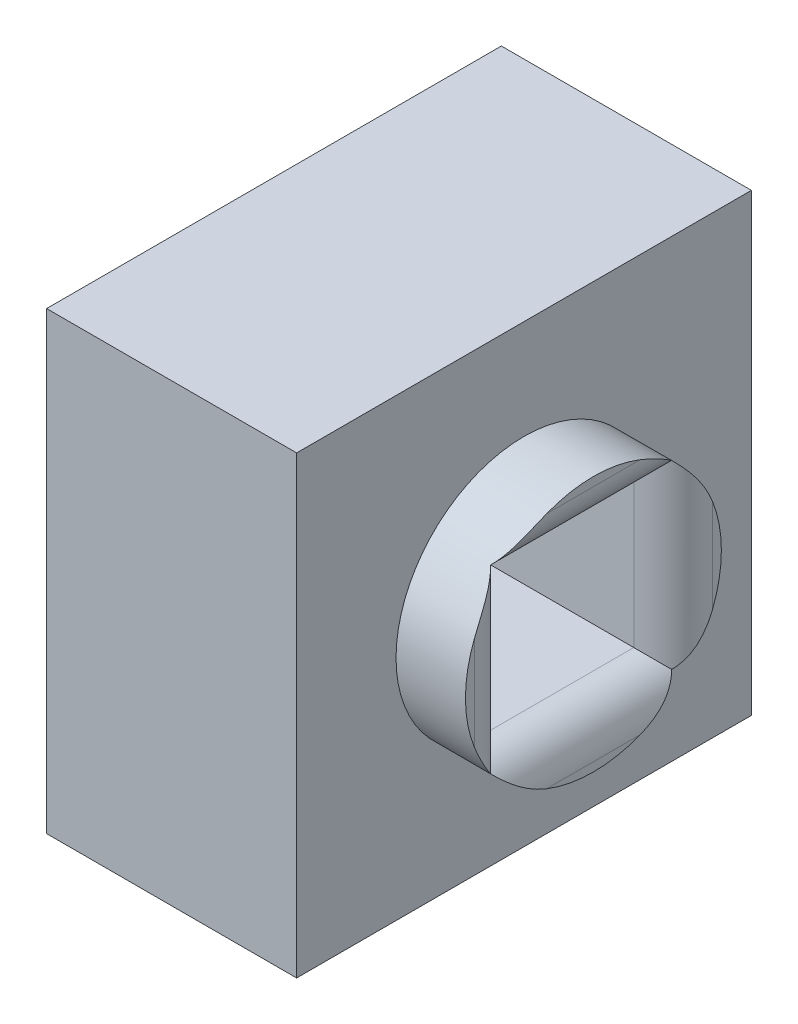
from build123d import *

# Parameters (mm, degrees)
SKETCH2_W           = 23.1
SKETCH2_H           = 23.1
SKETCH2_W_2         = 8.1
SKETCH2_H_2         = 8.1
EXTRUDE_THIN1_DEPTH = 12.7
SKETCH3_R           = 6.5
SKETCH3_W           = 8.1
SKETCH3_H           = 8.1
BOSS_EXTRUDE1_DEPTH = 3.525
FILLET1_R           = 2


with BuildPart() as part:
    # Sketch2 → Extrude-Thin1 (new body)
    with BuildSketch(Plane(origin=(0, 0, 0), x_dir=(0, 0, -1), z_dir=(1, 0, 0))):
        with Locations((4.05, 4.05)):
            Rectangle(SKETCH2_W, SKETCH2_H)
        with Locations((4.05, 4.05)):
            Rectangle(SKETCH2_W_2, SKETCH2_H_2, mode=Mode.SUBTRACT)
    extrude(amount=EXTRUDE_THIN1_DEPTH)

    # Sketch3 → Boss-Extrude1 (add)
    with BuildSketch(Plane(origin=(12.7, 0, 0), x_dir=(0, 0, -1), z_dir=(1, 0, 0))):
        with Locations((4.05, 4.05)):
            Circle(SKETCH3_R)
        with Locations((4.05, 4.05)):
            Rectangle(SKETCH3_W, SKETCH3_H, mode=Mode.SUBTRACT)
    extrude(amount=BOSS_EXTRUDE1_DEPTH)

    # Fillet1
    # the kernel refuses this fillet: 2 mm, written as the material it takes off along each edge
    with BuildSketch(Plane(origin=(0, 8.1, 0), x_dir=(1, 0, 0), z_dir=(0, -1, 0)), Plane(origin=(0, 0, 0), x_dir=(1, 0, 0), z_dir=(0, 0, -1)), Plane(origin=(0, 0, -8.1), x_dir=(1, 0, 0), z_dir=(0, 1, 0)), Plane(origin=(0, 8.1, -8.1), x_dir=(1, 0, 0), z_dir=(0, 0, 1))) as fillet1_piece_1:
        with BuildLine():
            CenterArc((FILLET1_R, FILLET1_R), FILLET1_R, 180, 90)
            Line((0, FILLET1_R), (-FILLET1_R * 0.02, FILLET1_R))
            Line((-FILLET1_R * 0.02, FILLET1_R), (-FILLET1_R * 0.02, -FILLET1_R * 0.02))
            Line((-FILLET1_R * 0.02, -FILLET1_R * 0.02), (FILLET1_R, -FILLET1_R * 0.02))
            Line((FILLET1_R, -FILLET1_R * 0.02), (FILLET1_R, 0))
        make_face()
    extrude(amount=8.1, mode=Mode.SUBTRACT)
    with BuildSketch(Plane(origin=(16.225, 0, -8.1), x_dir=(0, -1, 0), z_dir=(0, 0, 1)), Plane(origin=(16.225, 8.1, -8.1), x_dir=(0, 0, -1), z_dir=(0, -1, 0)), Plane(origin=(16.225, 8.1, 0), x_dir=(0, 1, 0), z_dir=(0, 0, -1)), Plane(origin=(16.225, 0, 0), x_dir=(0, 0, 1), z_dir=(0, 1, 0))) as fillet1_piece_2:
        with BuildLine():
            CenterArc((FILLET1_R, -FILLET1_R), FILLET1_R, 90, 90)
            Line((0, -FILLET1_R), (-FILLET1_R * 0.02, -FILLET1_R))
            Line((-FILLET1_R * 0.02, -FILLET1_R), (-FILLET1_R * 0.02, FILLET1_R * 0.02))
            Line((-FILLET1_R * 0.02, FILLET1_R * 0.02), (FILLET1_R, FILLET1_R * 0.02))
            Line((FILLET1_R, FILLET1_R * 0.02), (FILLET1_R, 0))
        make_face()
    extrude(amount=8.1, mode=Mode.SUBTRACT)
    with BuildSketch(Plane(origin=(0, 13.1, 0), x_dir=(1, 0, 0), z_dir=(0, -1, 0))) as fillet1_piece_3a_section:
        with BuildLine():
            CenterArc((FILLET1_R, FILLET1_R), FILLET1_R, 180, 90)
            Line((0, FILLET1_R), (-FILLET1_R * 0.02, FILLET1_R))
            Line((-FILLET1_R * 0.02, FILLET1_R), (-FILLET1_R * 0.02, -FILLET1_R * 0.02))
            Line((-FILLET1_R * 0.02, -FILLET1_R * 0.02), (FILLET1_R, -FILLET1_R * 0.02))
            Line((FILLET1_R, -FILLET1_R * 0.02), (FILLET1_R, 0))
        make_face()
    fillet1_piece_3a = extrude(amount=13.1, mode=Mode.PRIVATE)
    fillet1_piece_3a = split(fillet1_piece_3a, bisect_by=Plane(origin=(0.452790229, 8.1, 0.452790229), z_dir=(0, 1, 0)), keep=Keep.TOP, mode=Mode.PRIVATE)
    with BuildSketch(Plane(origin=(0, 8.1, -8.1), x_dir=(1, 0, 0), z_dir=(0, 0, 1))) as fillet1_piece_3b_section:
        with BuildLine():
            CenterArc((FILLET1_R, FILLET1_R), FILLET1_R, 180, 90)
            Line((0, FILLET1_R), (-FILLET1_R * 0.02, FILLET1_R))
            Line((-FILLET1_R * 0.02, FILLET1_R), (-FILLET1_R * 0.02, -FILLET1_R * 0.02))
            Line((-FILLET1_R * 0.02, -FILLET1_R * 0.02), (FILLET1_R, -FILLET1_R * 0.02))
            Line((FILLET1_R, -FILLET1_R * 0.02), (FILLET1_R, 0))
        make_face()
    fillet1_piece_3b = extrude(amount=13.1, mode=Mode.PRIVATE)
    fillet1_piece_3b = split(fillet1_piece_3b, bisect_by=Plane(origin=(0.452790229, 8.552790229, 0), z_dir=(0, 0, 1)), keep=Keep.TOP, mode=Mode.PRIVATE)
    fillet1_piece_3 = fillet1_piece_3a & fillet1_piece_3b
    add(fillet1_piece_3, mode=Mode.SUBTRACT)
    with BuildSketch(Plane(origin=(0, 8.1, 0), x_dir=(1, 0, 0), z_dir=(0, -1, 0))) as fillet1_piece_4a_section:
        with BuildLine():
            CenterArc((FILLET1_R, FILLET1_R), FILLET1_R, 180, 90)
            Line((0, FILLET1_R), (-FILLET1_R * 0.02, FILLET1_R))
            Line((-FILLET1_R * 0.02, FILLET1_R), (-FILLET1_R * 0.02, -FILLET1_R * 0.02))
            Line((-FILLET1_R * 0.02, -FILLET1_R * 0.02), (FILLET1_R, -FILLET1_R * 0.02))
            Line((FILLET1_R, -FILLET1_R * 0.02), (FILLET1_R, 0))
        make_face()
    fillet1_piece_4a = extrude(amount=13.1, mode=Mode.PRIVATE)
    fillet1_piece_4a = split(fillet1_piece_4a, bisect_by=Plane(origin=(0.452790229, 0, 0.452790229), z_dir=(0, -1, 0)), keep=Keep.TOP, mode=Mode.PRIVATE)
    with BuildSketch(Plane(origin=(0, 0, 5), x_dir=(1, 0, 0), z_dir=(0, 0, -1))) as fillet1_piece_4b_section:
        with BuildLine():
            CenterArc((FILLET1_R, FILLET1_R), FILLET1_R, 180, 90)
            Line((0, FILLET1_R), (-FILLET1_R * 0.02, FILLET1_R))
            Line((-FILLET1_R * 0.02, FILLET1_R), (-FILLET1_R * 0.02, -FILLET1_R * 0.02))
            Line((-FILLET1_R * 0.02, -FILLET1_R * 0.02), (FILLET1_R, -FILLET1_R * 0.02))
            Line((FILLET1_R, -FILLET1_R * 0.02), (FILLET1_R, 0))
        make_face()
    fillet1_piece_4b = extrude(amount=13.1, mode=Mode.PRIVATE)
    fillet1_piece_4b = split(fillet1_piece_4b, bisect_by=Plane(origin=(0.452790229, -0.452790229, 0), z_dir=(0, 0, 1)), keep=Keep.TOP, mode=Mode.PRIVATE)
    fillet1_piece_4 = fillet1_piece_4a & fillet1_piece_4b
    add(fillet1_piece_4, mode=Mode.SUBTRACT)
    with BuildSketch(Plane(origin=(0, 0, 0), x_dir=(1, 0, 0), z_dir=(0, 0, -1))) as fillet1_piece_5a_section:
        with BuildLine():
            CenterArc((FILLET1_R, FILLET1_R), FILLET1_R, 180, 90)
            Line((0, FILLET1_R), (-FILLET1_R * 0.02, FILLET1_R))
            Line((-FILLET1_R * 0.02, FILLET1_R), (-FILLET1_R * 0.02, -FILLET1_R * 0.02))
            Line((-FILLET1_R * 0.02, -FILLET1_R * 0.02), (FILLET1_R, -FILLET1_R * 0.02))
            Line((FILLET1_R, -FILLET1_R * 0.02), (FILLET1_R, 0))
        make_face()
    fillet1_piece_5a = extrude(amount=13.1, mode=Mode.PRIVATE)
    fillet1_piece_5a = split(fillet1_piece_5a, bisect_by=Plane(origin=(0.452790229, -0.452790229, -8.1), z_dir=(0, 0, -1)), keep=Keep.TOP, mode=Mode.PRIVATE)
    with BuildSketch(Plane(origin=(0, -5, -8.1), x_dir=(1, 0, 0), z_dir=(0, 1, 0))) as fillet1_piece_5b_section:
        with BuildLine():
            CenterArc((FILLET1_R, FILLET1_R), FILLET1_R, 180, 90)
            Line((0, FILLET1_R), (-FILLET1_R * 0.02, FILLET1_R))
            Line((-FILLET1_R * 0.02, FILLET1_R), (-FILLET1_R * 0.02, -FILLET1_R * 0.02))
            Line((-FILLET1_R * 0.02, -FILLET1_R * 0.02), (FILLET1_R, -FILLET1_R * 0.02))
            Line((FILLET1_R, -FILLET1_R * 0.02), (FILLET1_R, 0))
        make_face()
    fillet1_piece_5b = extrude(amount=13.1, mode=Mode.PRIVATE)
    fillet1_piece_5b = split(fillet1_piece_5b, bisect_by=Plane(origin=(0.452790229, 0, -8.552790229), z_dir=(0, -1, 0)), keep=Keep.TOP, mode=Mode.PRIVATE)
    fillet1_piece_5 = fillet1_piece_5a & fillet1_piece_5b
    add(fillet1_piece_5, mode=Mode.SUBTRACT)
    with BuildSketch(Plane(origin=(0, 0, -8.1), x_dir=(1, 0, 0), z_dir=(0, 1, 0))) as fillet1_piece_6a_section:
        with BuildLine():
            CenterArc((FILLET1_R, FILLET1_R), FILLET1_R, 180, 90)
            Line((0, FILLET1_R), (-FILLET1_R * 0.02, FILLET1_R))
            Line((-FILLET1_R * 0.02, FILLET1_R), (-FILLET1_R * 0.02, -FILLET1_R * 0.02))
            Line((-FILLET1_R * 0.02, -FILLET1_R * 0.02), (FILLET1_R, -FILLET1_R * 0.02))
            Line((FILLET1_R, -FILLET1_R * 0.02), (FILLET1_R, 0))
        make_face()
    fillet1_piece_6a = extrude(amount=13.1, mode=Mode.PRIVATE)
    fillet1_piece_6a = split(fillet1_piece_6a, bisect_by=Plane(origin=(0.452790229, 8.1, -8.552790229), z_dir=(0, 1, 0)), keep=Keep.TOP, mode=Mode.PRIVATE)
    with BuildSketch(Plane(origin=(0, 8.1, -13.1), x_dir=(1, 0, 0), z_dir=(0, 0, 1))) as fillet1_piece_6b_section:
        with BuildLine():
            CenterArc((FILLET1_R, FILLET1_R), FILLET1_R, 180, 90)
            Line((0, FILLET1_R), (-FILLET1_R * 0.02, FILLET1_R))
            Line((-FILLET1_R * 0.02, FILLET1_R), (-FILLET1_R * 0.02, -FILLET1_R * 0.02))
            Line((-FILLET1_R * 0.02, -FILLET1_R * 0.02), (FILLET1_R, -FILLET1_R * 0.02))
            Line((FILLET1_R, -FILLET1_R * 0.02), (FILLET1_R, 0))
        make_face()
    fillet1_piece_6b = extrude(amount=13.1, mode=Mode.PRIVATE)
    fillet1_piece_6b = split(fillet1_piece_6b, bisect_by=Plane(origin=(0.452790229, 8.552790229, -8.1), z_dir=(0, 0, -1)), keep=Keep.TOP, mode=Mode.PRIVATE)
    fillet1_piece_6 = fillet1_piece_6a & fillet1_piece_6b
    add(fillet1_piece_6, mode=Mode.SUBTRACT)
    with BuildSketch(Plane(origin=(16.225, 8.1, -8.1), x_dir=(0, 0, -1), z_dir=(0, -1, 0))) as fillet1_piece_7a_section:
        with BuildLine():
            CenterArc((FILLET1_R, -FILLET1_R), FILLET1_R, 90, 90)
            Line((0, -FILLET1_R), (-FILLET1_R * 0.02, -FILLET1_R))
            Line((-FILLET1_R * 0.02, -FILLET1_R), (-FILLET1_R * 0.02, FILLET1_R * 0.02))
            Line((-FILLET1_R * 0.02, FILLET1_R * 0.02), (FILLET1_R, FILLET1_R * 0.02))
            Line((FILLET1_R, FILLET1_R * 0.02), (FILLET1_R, 0))
        make_face()
    fillet1_piece_7a = extrude(amount=13.1, mode=Mode.PRIVATE)
    fillet1_piece_7a = split(fillet1_piece_7a, bisect_by=Plane(origin=(15.772209771, 0, -8.552790229), z_dir=(0, -1, 0)), keep=Keep.TOP, mode=Mode.PRIVATE)
    with BuildSketch(Plane(origin=(16.225, 0, -13.1), x_dir=(0, -1, 0), z_dir=(0, 0, 1))) as fillet1_piece_7b_section:
        with BuildLine():
            CenterArc((FILLET1_R, -FILLET1_R), FILLET1_R, 90, 90)
            Line((0, -FILLET1_R), (-FILLET1_R * 0.02, -FILLET1_R))
            Line((-FILLET1_R * 0.02, -FILLET1_R), (-FILLET1_R * 0.02, FILLET1_R * 0.02))
            Line((-FILLET1_R * 0.02, FILLET1_R * 0.02), (FILLET1_R, FILLET1_R * 0.02))
            Line((FILLET1_R, FILLET1_R * 0.02), (FILLET1_R, 0))
        make_face()
    fillet1_piece_7b = extrude(amount=13.1, mode=Mode.PRIVATE)
    fillet1_piece_7b = split(fillet1_piece_7b, bisect_by=Plane(origin=(15.772209771, -0.452790229, -8.1), z_dir=(0, 0, -1)), keep=Keep.TOP, mode=Mode.PRIVATE)
    fillet1_piece_7 = fillet1_piece_7a & fillet1_piece_7b
    add(fillet1_piece_7, mode=Mode.SUBTRACT)
    with BuildSketch(Plane(origin=(16.225, 0, -8.1), x_dir=(0, -1, 0), z_dir=(0, 0, 1))) as fillet1_piece_8a_section:
        with BuildLine():
            CenterArc((FILLET1_R, -FILLET1_R), FILLET1_R, 90, 90)
            Line((0, -FILLET1_R), (-FILLET1_R * 0.02, -FILLET1_R))
            Line((-FILLET1_R * 0.02, -FILLET1_R), (-FILLET1_R * 0.02, FILLET1_R * 0.02))
            Line((-FILLET1_R * 0.02, FILLET1_R * 0.02), (FILLET1_R, FILLET1_R * 0.02))
            Line((FILLET1_R, FILLET1_R * 0.02), (FILLET1_R, 0))
        make_face()
    fillet1_piece_8a = extrude(amount=13.1, mode=Mode.PRIVATE)
    fillet1_piece_8a = split(fillet1_piece_8a, bisect_by=Plane(origin=(15.772209771, -0.452790229, 0), z_dir=(0, 0, 1)), keep=Keep.TOP, mode=Mode.PRIVATE)
    with BuildSketch(Plane(origin=(16.225, -5, 0), x_dir=(0, 0, 1), z_dir=(0, 1, 0))) as fillet1_piece_8b_section:
        with BuildLine():
            CenterArc((FILLET1_R, -FILLET1_R), FILLET1_R, 90, 90)
            Line((0, -FILLET1_R), (-FILLET1_R * 0.02, -FILLET1_R))
            Line((-FILLET1_R * 0.02, -FILLET1_R), (-FILLET1_R * 0.02, FILLET1_R * 0.02))
            Line((-FILLET1_R * 0.02, FILLET1_R * 0.02), (FILLET1_R, FILLET1_R * 0.02))
            Line((FILLET1_R, FILLET1_R * 0.02), (FILLET1_R, 0))
        make_face()
    fillet1_piece_8b = extrude(amount=13.1, mode=Mode.PRIVATE)
    fillet1_piece_8b = split(fillet1_piece_8b, bisect_by=Plane(origin=(15.772209771, 0, 0.452790229), z_dir=(0, -1, 0)), keep=Keep.TOP, mode=Mode.PRIVATE)
    fillet1_piece_8 = fillet1_piece_8a & fillet1_piece_8b
    add(fillet1_piece_8, mode=Mode.SUBTRACT)
    with BuildSketch(Plane(origin=(16.225, 8.1, 0), x_dir=(0, 1, 0), z_dir=(0, 0, -1))) as fillet1_piece_9a_section:
        with BuildLine():
            CenterArc((FILLET1_R, -FILLET1_R), FILLET1_R, 90, 90)
            Line((0, -FILLET1_R), (-FILLET1_R * 0.02, -FILLET1_R))
            Line((-FILLET1_R * 0.02, -FILLET1_R), (-FILLET1_R * 0.02, FILLET1_R * 0.02))
            Line((-FILLET1_R * 0.02, FILLET1_R * 0.02), (FILLET1_R, FILLET1_R * 0.02))
            Line((FILLET1_R, FILLET1_R * 0.02), (FILLET1_R, 0))
        make_face()
    fillet1_piece_9a = extrude(amount=13.1, mode=Mode.PRIVATE)
    fillet1_piece_9a = split(fillet1_piece_9a, bisect_by=Plane(origin=(15.772209771, 8.552790229, -8.1), z_dir=(0, 0, -1)), keep=Keep.TOP, mode=Mode.PRIVATE)
    with BuildSketch(Plane(origin=(16.225, 13.1, -8.1), x_dir=(0, 0, -1), z_dir=(0, -1, 0))) as fillet1_piece_9b_section:
        with BuildLine():
            CenterArc((FILLET1_R, -FILLET1_R), FILLET1_R, 90, 90)
            Line((0, -FILLET1_R), (-FILLET1_R * 0.02, -FILLET1_R))
            Line((-FILLET1_R * 0.02, -FILLET1_R), (-FILLET1_R * 0.02, FILLET1_R * 0.02))
            Line((-FILLET1_R * 0.02, FILLET1_R * 0.02), (FILLET1_R, FILLET1_R * 0.02))
            Line((FILLET1_R, FILLET1_R * 0.02), (FILLET1_R, 0))
        make_face()
    fillet1_piece_9b = extrude(amount=13.1, mode=Mode.PRIVATE)
    fillet1_piece_9b = split(fillet1_piece_9b, bisect_by=Plane(origin=(15.772209771, 8.1, -8.552790229), z_dir=(0, 1, 0)), keep=Keep.TOP, mode=Mode.PRIVATE)
    fillet1_piece_9 = fillet1_piece_9a & fillet1_piece_9b
    add(fillet1_piece_9, mode=Mode.SUBTRACT)
    with BuildSketch(Plane(origin=(16.225, 8.1, 5), x_dir=(0, 1, 0), z_dir=(0, 0, -1))) as fillet1_piece_10a_section:
        with BuildLine():
            CenterArc((FILLET1_R, -FILLET1_R), FILLET1_R, 90, 90)
            Line((0, -FILLET1_R), (-FILLET1_R * 0.02, -FILLET1_R))
            Line((-FILLET1_R * 0.02, -FILLET1_R), (-FILLET1_R * 0.02, FILLET1_R * 0.02))
            Line((-FILLET1_R * 0.02, FILLET1_R * 0.02), (FILLET1_R, FILLET1_R * 0.02))
            Line((FILLET1_R, FILLET1_R * 0.02), (FILLET1_R, 0))
        make_face()
    fillet1_piece_10a = extrude(amount=13.1, mode=Mode.PRIVATE)
    fillet1_piece_10a = split(fillet1_piece_10a, bisect_by=Plane(origin=(15.772209771, 8.552790229, 0), z_dir=(0, 0, 1)), keep=Keep.TOP, mode=Mode.PRIVATE)
    with BuildSketch(Plane(origin=(16.225, 0, 0), x_dir=(0, 0, 1), z_dir=(0, 1, 0))) as fillet1_piece_10b_section:
        with BuildLine():
            CenterArc((FILLET1_R, -FILLET1_R), FILLET1_R, 90, 90)
            Line((0, -FILLET1_R), (-FILLET1_R * 0.02, -FILLET1_R))
            Line((-FILLET1_R * 0.02, -FILLET1_R), (-FILLET1_R * 0.02, FILLET1_R * 0.02))
            Line((-FILLET1_R * 0.02, FILLET1_R * 0.02), (FILLET1_R, FILLET1_R * 0.02))
            Line((FILLET1_R, FILLET1_R * 0.02), (FILLET1_R, 0))
        make_face()
    fillet1_piece_10b = extrude(amount=13.1, mode=Mode.PRIVATE)
    fillet1_piece_10b = split(fillet1_piece_10b, bisect_by=Plane(origin=(15.772209771, 8.1, 0.452790229), z_dir=(0, 1, 0)), keep=Keep.TOP, mode=Mode.PRIVATE)
    fillet1_piece_10 = fillet1_piece_10a & fillet1_piece_10b
    add(fillet1_piece_10, mode=Mode.SUBTRACT)


solid = part.part
